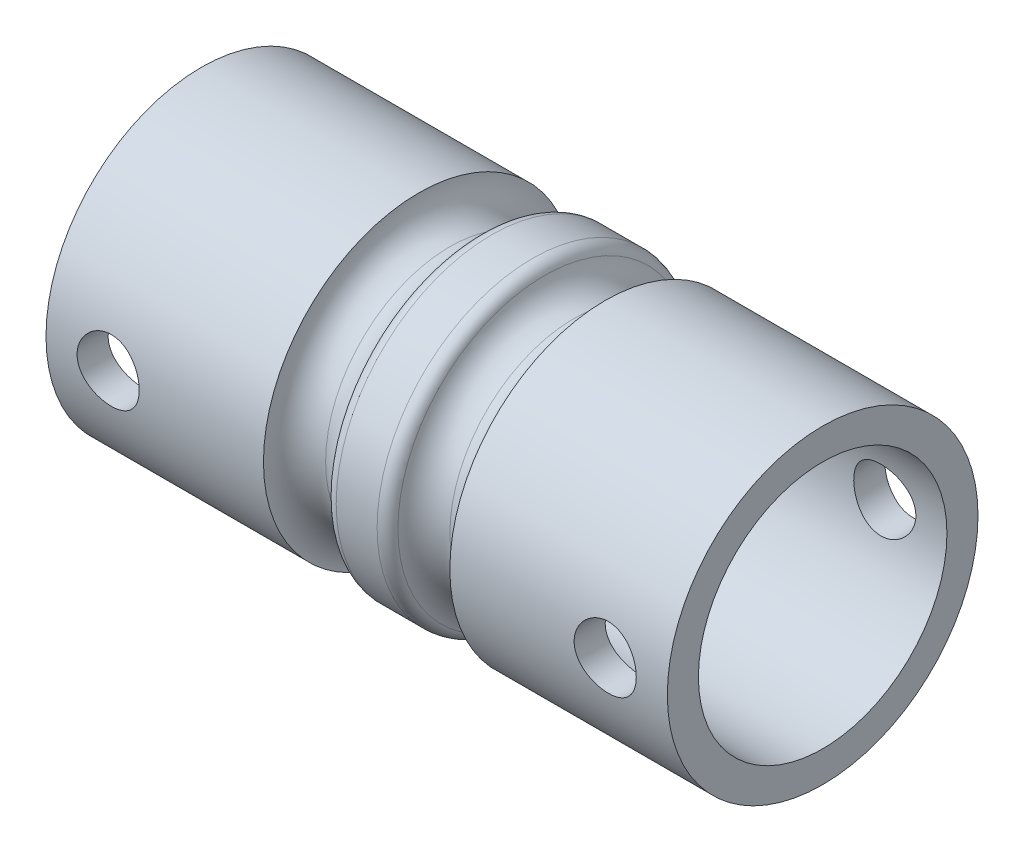
from build123d import *

# Parameters (mm, degrees)
SKETCH1_R               = 12.5
SKETCH1_R_2             = 10
BOSS_EXTRUDE1_DEPTH     = 50
SKETCH2_R               = 2.5
CUT_EXTRUDE1_DEPTH      = 54.033008636
CUT_EXTRUDE1_DEPTH_BACK = 54.033008636
SKETCH3_R               = 2.5


with BuildPart() as part:
    # Sketch1 → Boss-Extrude1 (new body)
    with BuildSketch(Plane(origin=(0, 0, 0), x_dir=(0, 0, -1), z_dir=(1, 0, 0))):
        Circle(SKETCH1_R)
        Circle(SKETCH1_R_2, mode=Mode.SUBTRACT)
    extrude(amount=BOSS_EXTRUDE1_DEPTH)

    # Sketch2 → Cut-Revolve1 (revolve, cut)
    with BuildSketch(Plane.XY, mode=Mode.PRIVATE) as cut_revolve1_sk:
        with Locations((20, 12.5)):
            Circle(SKETCH2_R)
        with Locations((30, 12.5)):
            Circle(SKETCH2_R)
    revolve(cut_revolve1_sk.sketch.rotate(Axis((-6.359796463, 0, 0), (1, 0, 0)), 90), axis=Axis((-6.359796463, 0, 0), (1, 0, 0)), mode=Mode.SUBTRACT)


with BuildPart() as cut_revolve1_piece_1:
    # of the separate pieces the step leaves, piece 1, a body of its own (cut_revolve1_pieces)
    add(part.part.solids().sort_by_distance((32.5, 0, -12.5))[0])


with BuildPart() as cut_revolve1_piece_2:
    # of the separate pieces the step leaves, piece 2, a body of its own (cut_revolve1_pieces)
    add(part.part.solids().sort_by_distance((0, 0, -10))[0])


with BuildPart() as cut_revolve1_piece_3:
    # of the separate pieces the step leaves, piece 3, a body of its own (cut_revolve1_pieces)
    add(part.part.solids().sort_by_distance((27.5, 0, -12.5))[0])

    # Fillet1: read off the stored shape, not the designer's step
    # Fillet1 outline → Fillet1 (revolve, cut)
    with BuildSketch(Plane.YX):
        with BuildLine():
            Line((12.5, 27.604212881), (11.785714286, 27.604212881))
            ThreePointArc((11.785714286, 27.604212881), (12.301783726, 27.243512338), (12.5, 26.645898034))
            Line((12.5, 26.645898034), (12.5, 27.604212881))
        make_face()
        with BuildLine():
            Line((12.5, 22.395787119), (12.5, 23.354101966))
            ThreePointArc((12.5, 23.354101966), (12.301783726, 22.756487662), (11.785714286, 22.395787119))
            Line((11.785714286, 22.395787119), (12.5, 22.395787119))
        make_face()
    revolve(axis=Axis((0, 0, 0), (1, 0, 0)), mode=Mode.SUBTRACT)


with BuildPart() as cut_extrude1_tool:
    # Sketch3 → Cut-Extrude1 (new, two sides: drawn at the far end of the back side and taken through both)
    with BuildSketch(Plane.XY.offset(-CUT_EXTRUDE1_DEPTH_BACK)):
        with Locations((5, 0)):
            Circle(SKETCH3_R)
        with Locations((45, 0)):
            Circle(SKETCH3_R)
    extrude(amount=CUT_EXTRUDE1_DEPTH + CUT_EXTRUDE1_DEPTH_BACK)


with BuildPart() as cut_revolve1_piece_1_1:
    add(cut_revolve1_piece_1.part)

    # Cut-Extrude1: cut by cut_extrude1_tool
    add(cut_extrude1_tool.part, mode=Mode.SUBTRACT)


with BuildPart() as cut_revolve1_piece_2_1:
    add(cut_revolve1_piece_2.part)

    # Cut-Extrude1: cut by cut_extrude1_tool
    add(cut_extrude1_tool.part, mode=Mode.SUBTRACT)


solid = Compound([cut_revolve1_piece_3.part, cut_revolve1_piece_1_1.part, cut_revolve1_piece_2_1.part])
